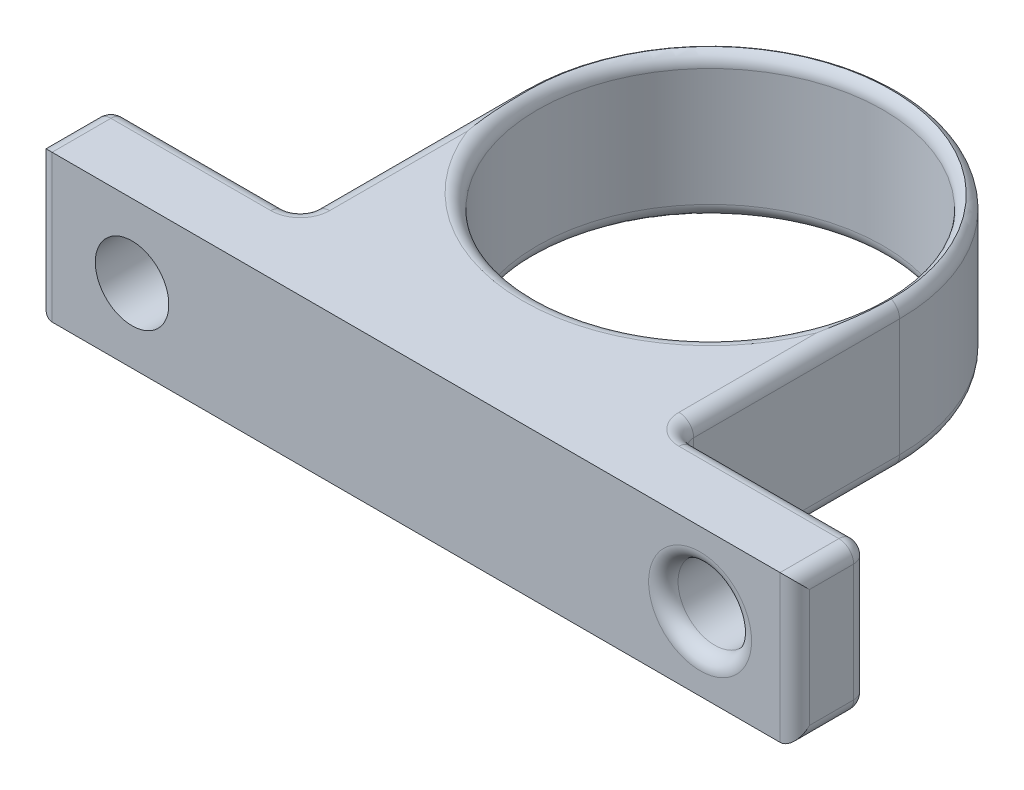
from build123d import *

# Parameters (mm, degrees)
SKETCH1_R           = 25.75
BOSS_EXTRUDE1_DEPTH = 20
SKETCH3_W           = 51.5
SKETCH3_H           = 30
BOSS_EXTRUDE2_DEPTH = 20
SKETCH2_R           = 23.5
CUT_EXTRUDE1_DEPTH  = 20
SKETCH6_W           = 51.5
SKETCH6_H           = 20
BOSS_EXTRUDE3_DEPTH = 10
LPATTERN1_COUNT     = 2
LPATTERN1_PITCH     = 51.5
SKETCH7_R           = 5
CUT_EXTRUDE2_DEPTH  = 10
LPATTERN2_COUNT     = 2
LPATTERN2_PITCH     = 77.25
FILLET3_R           = 2


with BuildPart() as part:
    # Sketch1 → Boss-Extrude1 (new body)
    with BuildSketch(Plane(origin=(0, 0, 0), x_dir=(1, 0, 0), z_dir=(0, 1, 0))):
        with Locations(Location((0, 0, 0), (0, 0, 270))):
            Circle(SKETCH1_R)
    extrude(amount=BOSS_EXTRUDE1_DEPTH)

    # Sketch3 → Boss-Extrude2 (add)
    with BuildSketch(Plane(origin=(0, 20, 0), x_dir=(1, 0, 0), z_dir=(0, 1, 0))):
        with Locations((0, -15)):
            Rectangle(SKETCH3_W, SKETCH3_H)
    extrude(amount=-BOSS_EXTRUDE2_DEPTH)

    # Sketch2 → Cut-Extrude1 (cut)
    with BuildSketch(Plane(origin=(0, 20, 0), x_dir=(1, 0, 0), z_dir=(0, 1, 0))):
        with Locations(Location((0, 0, 0), (0, 0, 270))):
            Circle(SKETCH2_R)
    extrude(amount=-CUT_EXTRUDE1_DEPTH, mode=Mode.SUBTRACT)

    # Sketch6 → Boss-Extrude3 (add)
    with BuildSketch(Plane.XY.offset(30)):
        with Locations((-25.75, 10)):
            Rectangle(SKETCH6_W, SKETCH6_H)
    boss_extrude3 = extrude(amount=BOSS_EXTRUDE3_DEPTH)

    # LPattern1: Boss-Extrude3 ×2
    with Locations(*[(i * LPATTERN1_PITCH, 0, 0) for i in range(1, LPATTERN1_COUNT)]):
        add(boss_extrude3)

    # Sketch7 → Cut-Extrude2 (cut)
    with BuildSketch(Plane(origin=(0, 0, 30), x_dir=(-1, 0, 0), z_dir=(0, 0, -1))):
        with Locations((-38.625, 10)):
            Circle(SKETCH7_R)
    cut_extrude2 = extrude(amount=-CUT_EXTRUDE2_DEPTH, mode=Mode.SUBTRACT)

    # LPattern2: Cut-Extrude2 ×2
    with Locations(*[(-i * LPATTERN2_PITCH, 0, 0) for i in range(1, LPATTERN2_COUNT)]):
        add(cut_extrude2, mode=Mode.SUBTRACT)

    # Fillet3
    # the kernel refuses this fillet: 2 mm, written as the material it adds along each edge
    with BuildSketch(Plane(origin=(25.75, 20, 30), x_dir=(1, 0, 0), z_dir=(0, -1, 0)), Plane(origin=(-25.75, 20, 30), x_dir=(0, 0, -1), z_dir=(0, -1, 0))) as fillet3_piece_1:
        with BuildLine():
            CenterArc((FILLET3_R, -FILLET3_R), FILLET3_R, 90, 90)
            Line((0, -FILLET3_R), (0, 0))
            Line((0, 0), (FILLET3_R, 0))
        make_face()
    extrude(amount=20)
    # the kernel refuses this fillet: 2 mm, written as the material it takes off along each edge
    with BuildSketch(Plane(origin=(0, 0, 0), x_dir=(0, 0, 1), z_dir=(-1, 0, 0))) as fillet3_2_piece_1:
        with BuildLine():
            CenterArc((23.5 + FILLET3_R, FILLET3_R), FILLET3_R, 180, 90)
            Line((23.5, FILLET3_R), (23.5, 0))
            Line((23.5, 0), (23.5 + FILLET3_R, 0))
        make_face()
    revolve(axis=Axis((0, 0, 0), (0, 1, 0)), mode=Mode.SUBTRACT)
    with BuildSketch(Plane(origin=(0, 20, 0), x_dir=(0, 0, 1), z_dir=(-1, 0, 0))) as fillet3_2_piece_2:
        with BuildLine():
            CenterArc((23.5 + FILLET3_R, -FILLET3_R), FILLET3_R, 90, 90)
            Line((23.5 + FILLET3_R, 0), (23.5, 0))
            Line((23.5, 0), (23.5, -FILLET3_R))
        make_face()
    revolve(axis=Axis((0, 20, 0), (0, 1, 0)), mode=Mode.SUBTRACT)
    with BuildSketch(Plane(origin=(-51.5, -5, 30), x_dir=(1, 0, 0), z_dir=(0, 1, 0)), Plane(origin=(-51.5, -5, 40), x_dir=(0, 0, -1), z_dir=(0, 1, 0))) as fillet3_2_piece_3:
        with BuildLine():
            CenterArc((FILLET3_R, -FILLET3_R), FILLET3_R, 90, 90)
            Line((0, -FILLET3_R), (0, 0))
            Line((0, 0), (FILLET3_R, 0))
        make_face()
    extrude(amount=30, mode=Mode.SUBTRACT)
    with BuildSketch(Plane(origin=(-51.5, 20, 25), x_dir=(0, -1, 0), z_dir=(0, 0, 1)), Plane(origin=(-51.5, 0, 25), x_dir=(1, 0, 0), z_dir=(0, 0, 1))) as fillet3_2_piece_4:
        with BuildLine():
            CenterArc((FILLET3_R, FILLET3_R), FILLET3_R, 180, 90)
            Line((0, FILLET3_R), (0, 0))
            Line((0, 0), (FILLET3_R, 0))
        make_face()
    extrude(amount=20, mode=Mode.SUBTRACT)
    with BuildSketch(Plane(origin=(51.5, 25, 30), x_dir=(0, 0, 1), z_dir=(0, -1, 0)), Plane(origin=(51.5, 25, 40), x_dir=(-1, 0, 0), z_dir=(0, -1, 0))) as fillet3_2_piece_5:
        with BuildLine():
            CenterArc((FILLET3_R, FILLET3_R), FILLET3_R, 180, 90)
            Line((0, FILLET3_R), (0, 0))
            Line((0, 0), (FILLET3_R, 0))
        make_face()
    extrude(amount=30, mode=Mode.SUBTRACT)
    with BuildSketch(Plane(origin=(51.5, 0, 25), x_dir=(-1, 0, 0), z_dir=(0, 0, 1)), Plane(origin=(51.5, 20, 25), x_dir=(0, -1, 0), z_dir=(0, 0, 1))) as fillet3_2_piece_6:
        with BuildLine():
            CenterArc((FILLET3_R, -FILLET3_R), FILLET3_R, 90, 90)
            Line((0, -FILLET3_R), (0, 0))
            Line((0, 0), (FILLET3_R, 0))
        make_face()
    extrude(amount=20, mode=Mode.SUBTRACT)
    with BuildSketch(Plane(origin=(38.625, 10, 40), x_dir=(-1, 0, 0), z_dir=(0, -1, 0))) as fillet3_2_piece_7:
        with BuildLine():
            CenterArc((5 + FILLET3_R, FILLET3_R), FILLET3_R, 180, 90)
            Line((5, FILLET3_R), (5, 0))
            Line((5, 0), (5 + FILLET3_R, 0))
        make_face()
    revolve(axis=Axis((38.625, 10, 40), (0, 0, -1)), mode=Mode.SUBTRACT)
    with BuildSketch(Plane(origin=(38.625, 10, 30), x_dir=(-1, 0, 0), z_dir=(0, -1, 0))) as fillet3_2_piece_8:
        with BuildLine():
            CenterArc((5 + FILLET3_R, -FILLET3_R), FILLET3_R, 90, 90)
            Line((5, -FILLET3_R), (5, 0))
            Line((5, 0), (5 + FILLET3_R, 0))
        make_face()
    revolve(axis=Axis((38.625, 10, 30), (0, 0, -1)), mode=Mode.SUBTRACT)
    with BuildSketch(Plane(origin=(-38.625, 10, 30), x_dir=(-1, 0, 0), z_dir=(0, -1, 0))) as fillet3_2_piece_9:
        with BuildLine():
            CenterArc((5 + FILLET3_R, -FILLET3_R), FILLET3_R, 90, 90)
            Line((5, -FILLET3_R), (5, 0))
            Line((5, 0), (5 + FILLET3_R, 0))
        make_face()
    revolve(axis=Axis((-38.625, 10, 30), (0, 0, -1)), mode=Mode.SUBTRACT)
    # the kernel refuses this fillet: 2 mm, written as the material it takes off along each edge
    with BuildSketch(Plane(origin=(49.5, 2, 32), x_dir=(0, 0, -1), z_dir=(0, -1, 0))) as fillet3_3_piece_1_section:
        Polygon((0, 0), (FILLET3_R, 0), (FILLET3_R, FILLET3_R), (0, FILLET3_R), align=None)
    fillet3_3_piece_1 = extrude(amount=FILLET3_R, mode=Mode.PRIVATE)
    fillet3_3_piece_1 = fillet3_3_piece_1 - Plane(origin=(49.5, 2, 32), x_dir=(-0.7071067811865475, 0, 0.7071067811865475), z_dir=(0, -1, 0)) * Sphere(FILLET3_R, mode=Mode.PRIVATE)
    add(fillet3_3_piece_1, mode=Mode.SUBTRACT)
    with BuildSketch(Plane(origin=(49.5, 18, 32), x_dir=(0, 1, 0), z_dir=(0, 0, -1))) as fillet3_3_piece_2_section:
        Polygon((0, 0), (FILLET3_R, 0), (FILLET3_R, FILLET3_R), (0, FILLET3_R), align=None)
    fillet3_3_piece_2 = extrude(amount=FILLET3_R, mode=Mode.PRIVATE)
    fillet3_3_piece_2 = fillet3_3_piece_2 - Plane(origin=(49.5, 18, 32), x_dir=(-0.7071067811865475, -0.7071067811865475, 0), z_dir=(0, 0, -1)) * Sphere(FILLET3_R, mode=Mode.PRIVATE)
    add(fillet3_3_piece_2, mode=Mode.SUBTRACT)
    with BuildSketch(Plane(origin=(-49.5, 2, 32), x_dir=(0, 0, -1), z_dir=(0, -1, 0))) as fillet3_3_piece_3_section:
        Polygon((0, 0), (FILLET3_R, 0), (FILLET3_R, -FILLET3_R), (0, -FILLET3_R), align=None)
    fillet3_3_piece_3 = extrude(amount=FILLET3_R, mode=Mode.PRIVATE)
    fillet3_3_piece_3 = fillet3_3_piece_3 - Plane(origin=(-49.5, 2, 32), x_dir=(0.7071067811865475, 0, 0.7071067811865475), z_dir=(0, -1, 0)) * Sphere(FILLET3_R, mode=Mode.PRIVATE)
    add(fillet3_3_piece_3, mode=Mode.SUBTRACT)
    with BuildSketch(Plane(origin=(-49.5, 18, 32), x_dir=(0, 1, 0), z_dir=(0, 0, -1))) as fillet3_3_piece_4_section:
        Polygon((0, 0), (FILLET3_R, 0), (FILLET3_R, -FILLET3_R), (0, -FILLET3_R), align=None)
    fillet3_3_piece_4 = extrude(amount=FILLET3_R, mode=Mode.PRIVATE)
    fillet3_3_piece_4 = fillet3_3_piece_4 - Plane(origin=(-49.5, 18, 32), x_dir=(0.7071067811865475, -0.7071067811865475, 0), z_dir=(0, 0, -1)) * Sphere(FILLET3_R, mode=Mode.PRIVATE)
    add(fillet3_3_piece_4, mode=Mode.SUBTRACT)
    with BuildSketch(Plane(origin=(25.75, 0, 0), x_dir=(-1, 0, 0), z_dir=(0, 0, 1)), Plane(origin=(-25.75, 20, 28), x_dir=(0, -1, 0), z_dir=(0, 0, -1)), Plane(origin=(25.75, 20, 0), x_dir=(0, -1, 0), z_dir=(0, 0, 1)), Plane(origin=(-25.75, 0, 28), x_dir=(1, 0, 0), z_dir=(0, 0, -1))) as fillet3_3_piece_5:
        with BuildLine():
            CenterArc((FILLET3_R, -FILLET3_R), FILLET3_R, 90, 90)
            Line((0, -FILLET3_R), (0, 0))
            Line((0, 0), (FILLET3_R, 0))
        make_face()
    extrude(amount=28, mode=Mode.SUBTRACT)
    with BuildSketch(Plane(origin=(0, 0, 0), x_dir=(1, 0, 0), z_dir=(0, 0, 1))) as fillet3_3_piece_6:
        with BuildLine():
            CenterArc((25.75 - FILLET3_R, FILLET3_R), FILLET3_R, 270, 90)
            Line((25.75, FILLET3_R), (25.75, 0))
            Line((25.75, 0), (25.75 - FILLET3_R, 0))
        make_face()
    revolve(axis=Axis((0, 0, 0), (0, 1, 0)), revolution_arc=180, mode=Mode.SUBTRACT)
    with BuildSketch(Plane(origin=(-49.5, 20, 30), x_dir=(0, -1, 0), z_dir=(1, 0, 0)), Plane(origin=(27.75, 20, 30), x_dir=(0, -1, 0), z_dir=(1, 0, 0))) as fillet3_3_piece_7:
        with BuildLine():
            CenterArc((FILLET3_R, -FILLET3_R), FILLET3_R, 90, 90)
            Line((0, -FILLET3_R), (0, 0))
            Line((0, 0), (FILLET3_R, 0))
        make_face()
    extrude(amount=21.75, mode=Mode.SUBTRACT)
    with BuildSketch(Plane(origin=(-27.75, 0, 30), x_dir=(0, 0, 1), z_dir=(-1, 0, 0)), Plane(origin=(49.5, 0, 30), x_dir=(0, 0, 1), z_dir=(-1, 0, 0))) as fillet3_3_piece_8:
        with BuildLine():
            CenterArc((FILLET3_R, FILLET3_R), FILLET3_R, 180, 90)
            Line((0, FILLET3_R), (0, 0))
            Line((0, 0), (FILLET3_R, 0))
        make_face()
    extrude(amount=21.75, mode=Mode.SUBTRACT)
    with BuildSketch(Plane(origin=(0, 20, 0), x_dir=(1, 0, 0), z_dir=(0, 0, 1))) as fillet3_3_piece_9:
        with BuildLine():
            CenterArc((25.75 - FILLET3_R, -FILLET3_R), FILLET3_R, 0, 90)
            Line((25.75 - FILLET3_R, 0), (25.75, 0))
            Line((25.75, 0), (25.75, -FILLET3_R))
        make_face()
    revolve(axis=Axis((0, 20, 0), (0, 1, 0)), revolution_arc=180, mode=Mode.SUBTRACT)
    with BuildSketch(Plane(origin=(-27.75, 0, 28), x_dir=(1, 0, 0), z_dir=(0, 0, -1))) as fillet3_3_piece_10:
        with BuildLine():
            CenterArc((2 + FILLET3_R, -FILLET3_R), FILLET3_R, 90, 90)
            Line((2, -FILLET3_R), (2, 0))
            Line((2, 0), (2 + FILLET3_R, 0))
        make_face()
    revolve(axis=Axis((-27.75, 0, 28), (0, -1, 0)), revolution_arc=90, mode=Mode.SUBTRACT)
    with BuildSketch(Plane(origin=(27.75, 20, 28), x_dir=(0, 0, 1), z_dir=(1, 0, 0))) as fillet3_3_piece_11:
        with BuildLine():
            CenterArc((2 + FILLET3_R, FILLET3_R), FILLET3_R, 180, 90)
            Line((2 + FILLET3_R, 0), (2, 0))
            Line((2, 0), (2, FILLET3_R))
        make_face()
    revolve(axis=Axis((27.75, 20, 28), (0, -1, 0)), revolution_arc=90, mode=Mode.SUBTRACT)
    with BuildSketch(Plane(origin=(27.75, 0, 28), x_dir=(0, 0, 1), z_dir=(1, 0, 0))) as fillet3_3_piece_12:
        with BuildLine():
            CenterArc((2 + FILLET3_R, -FILLET3_R), FILLET3_R, 90, 90)
            Line((2, -FILLET3_R), (2, 0))
            Line((2, 0), (2 + FILLET3_R, 0))
        make_face()
    revolve(axis=Axis((27.75, 0, 28), (0, -1, 0)), revolution_arc=90, mode=Mode.SUBTRACT)
    with BuildSketch(Plane(origin=(-27.75, 20, 28), x_dir=(1, 0, 0), z_dir=(0, 0, -1))) as fillet3_3_piece_13:
        with BuildLine():
            CenterArc((2 + FILLET3_R, FILLET3_R), FILLET3_R, 180, 90)
            Line((2 + FILLET3_R, 0), (2, 0))
            Line((2, 0), (2, FILLET3_R))
        make_face()
    revolve(axis=Axis((-27.75, 20, 28), (0, -1, 0)), revolution_arc=90, mode=Mode.SUBTRACT)


solid = part.part
